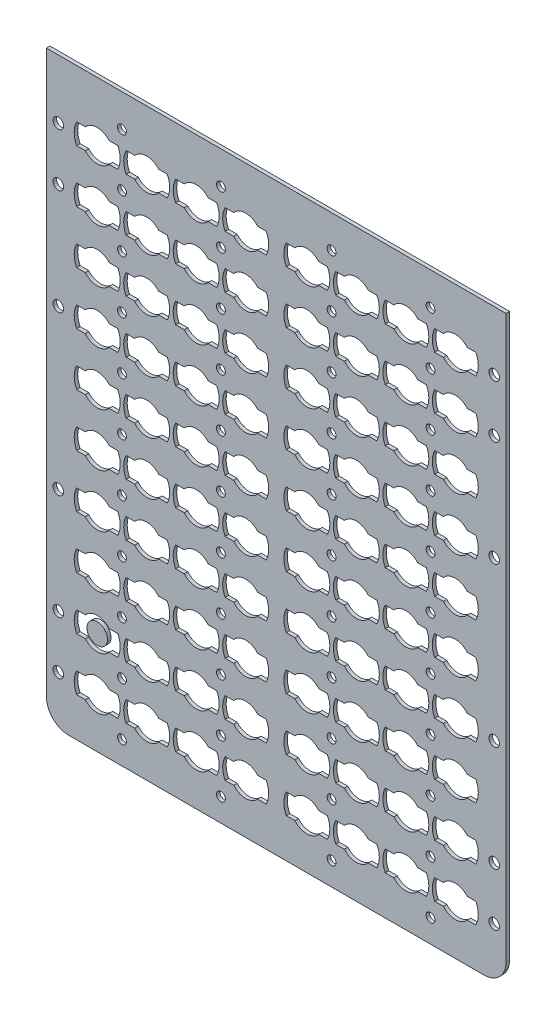
from build123d import *

# Parameters (mm, degrees)
SKETCH1_W            = 209.976
SKETCH1_H            = 266.785000002
SKETCH1_R            = 10.5
SKETCH1_R_2          = 1.527369009
SKETCH1_R_3          = 2.032
BOSS_EXTRUDE1_DEPTH  = 1.6
M4_CLEARANCE_HOLE1_D = 4.8
FILLET1_R            = 10.16
SKETCH5_R            = 4.699999998
SKETCH5_R_2          = 2.032
BOSS_EXTRUDE2_DEPTH  = 1.6


with BuildPart() as part:
    # Sketch1 → Boss-Extrude1 (new body)
    with BuildSketch(Plane.XY):
        with Locations((81.788, 110.787499999)):
            Rectangle(SKETCH1_W, SKETCH1_H)
        Circle(SKETCH1_R, mode=Mode.SUBTRACT)
        with Locations((22.606, 0)):
            Circle(SKETCH1_R, mode=Mode.SUBTRACT)
        with Locations((45.212, 0)):
            Circle(SKETCH1_R, mode=Mode.SUBTRACT)
        with Locations((67.818, 0)):
            Circle(SKETCH1_R, mode=Mode.SUBTRACT)
        with Locations((22.606, 24.13)):
            Circle(SKETCH1_R, mode=Mode.SUBTRACT)
        with Locations((45.212, 24.13)):
            Circle(SKETCH1_R, mode=Mode.SUBTRACT)
        with Locations((67.818, 24.13)):
            Circle(SKETCH1_R, mode=Mode.SUBTRACT)
        with Locations((22.606, 48.26)):
            Circle(SKETCH1_R, mode=Mode.SUBTRACT)
        with Locations((45.212, 48.26)):
            Circle(SKETCH1_R, mode=Mode.SUBTRACT)
        with Locations((67.818, 48.26)):
            Circle(SKETCH1_R, mode=Mode.SUBTRACT)
        with Locations((22.606, 72.39)):
            Circle(SKETCH1_R, mode=Mode.SUBTRACT)
        with Locations((45.212, 72.39)):
            Circle(SKETCH1_R, mode=Mode.SUBTRACT)
        with Locations((67.818, 72.39)):
            Circle(SKETCH1_R, mode=Mode.SUBTRACT)
        with Locations((22.606, 96.52)):
            Circle(SKETCH1_R, mode=Mode.SUBTRACT)
        with Locations((45.212, 96.52)):
            Circle(SKETCH1_R, mode=Mode.SUBTRACT)
        with Locations((67.818, 96.52)):
            Circle(SKETCH1_R, mode=Mode.SUBTRACT)
        with Locations((22.606, 120.65)):
            Circle(SKETCH1_R, mode=Mode.SUBTRACT)
        with Locations((45.212, 120.65)):
            Circle(SKETCH1_R, mode=Mode.SUBTRACT)
        with Locations((67.818, 120.65)):
            Circle(SKETCH1_R, mode=Mode.SUBTRACT)
        with Locations((22.606, 144.78)):
            Circle(SKETCH1_R, mode=Mode.SUBTRACT)
        with Locations((45.212, 144.78)):
            Circle(SKETCH1_R, mode=Mode.SUBTRACT)
        with Locations((67.818, 144.78)):
            Circle(SKETCH1_R, mode=Mode.SUBTRACT)
        with Locations((22.606, 168.91)):
            Circle(SKETCH1_R, mode=Mode.SUBTRACT)
        with Locations((45.212, 168.91)):
            Circle(SKETCH1_R, mode=Mode.SUBTRACT)
        with Locations((67.818, 168.91)):
            Circle(SKETCH1_R, mode=Mode.SUBTRACT)
        with Locations((22.606, 193.04)):
            Circle(SKETCH1_R, mode=Mode.SUBTRACT)
        with Locations((45.212, 193.04)):
            Circle(SKETCH1_R, mode=Mode.SUBTRACT)
        with Locations((67.818, 193.04)):
            Circle(SKETCH1_R, mode=Mode.SUBTRACT)
        with Locations((22.606, 217.17)):
            Circle(SKETCH1_R, mode=Mode.SUBTRACT)
        with Locations((45.212, 217.17)):
            Circle(SKETCH1_R, mode=Mode.SUBTRACT)
        with Locations((67.818, 217.17)):
            Circle(SKETCH1_R, mode=Mode.SUBTRACT)
        with Locations((0, 24.13)):
            Circle(SKETCH1_R, mode=Mode.SUBTRACT)
        with Locations((0, 48.26)):
            Circle(SKETCH1_R, mode=Mode.SUBTRACT)
        with Locations((0, 72.39)):
            Circle(SKETCH1_R, mode=Mode.SUBTRACT)
        with Locations((0, 96.52)):
            Circle(SKETCH1_R, mode=Mode.SUBTRACT)
        with Locations((0, 120.65)):
            Circle(SKETCH1_R, mode=Mode.SUBTRACT)
        with Locations((0, 144.78)):
            Circle(SKETCH1_R, mode=Mode.SUBTRACT)
        with Locations((0, 168.91)):
            Circle(SKETCH1_R, mode=Mode.SUBTRACT)
        with Locations((0, 193.04)):
            Circle(SKETCH1_R, mode=Mode.SUBTRACT)
        with Locations((0, 217.17)):
            Circle(SKETCH1_R, mode=Mode.SUBTRACT)
        with Locations((95.758, 0)):
            Circle(SKETCH1_R, mode=Mode.SUBTRACT)
        with Locations((118.364, 0)):
            Circle(SKETCH1_R, mode=Mode.SUBTRACT)
        with Locations((140.97, 0)):
            Circle(SKETCH1_R, mode=Mode.SUBTRACT)
        with Locations((163.576, 0)):
            Circle(SKETCH1_R, mode=Mode.SUBTRACT)
        with Locations((118.364, 24.13)):
            Circle(SKETCH1_R, mode=Mode.SUBTRACT)
        with Locations((140.97, 24.13)):
            Circle(SKETCH1_R, mode=Mode.SUBTRACT)
        with Locations((163.576, 24.13)):
            Circle(SKETCH1_R, mode=Mode.SUBTRACT)
        with Locations((118.364, 48.26)):
            Circle(SKETCH1_R, mode=Mode.SUBTRACT)
        with Locations((140.97, 48.26)):
            Circle(SKETCH1_R, mode=Mode.SUBTRACT)
        with Locations((163.576, 48.26)):
            Circle(SKETCH1_R, mode=Mode.SUBTRACT)
        with Locations((118.364, 72.39)):
            Circle(SKETCH1_R, mode=Mode.SUBTRACT)
        with Locations((140.97, 72.39)):
            Circle(SKETCH1_R, mode=Mode.SUBTRACT)
        with Locations((163.576, 72.39)):
            Circle(SKETCH1_R, mode=Mode.SUBTRACT)
        with Locations((118.364, 96.52)):
            Circle(SKETCH1_R, mode=Mode.SUBTRACT)
        with Locations((140.97, 96.52)):
            Circle(SKETCH1_R, mode=Mode.SUBTRACT)
        with Locations((163.576, 96.52)):
            Circle(SKETCH1_R, mode=Mode.SUBTRACT)
        with Locations((118.364, 120.65)):
            Circle(SKETCH1_R, mode=Mode.SUBTRACT)
        with Locations((140.97, 120.65)):
            Circle(SKETCH1_R, mode=Mode.SUBTRACT)
        with Locations((163.576, 120.65)):
            Circle(SKETCH1_R, mode=Mode.SUBTRACT)
        with Locations((118.364, 144.78)):
            Circle(SKETCH1_R, mode=Mode.SUBTRACT)
        with Locations((140.97, 144.78)):
            Circle(SKETCH1_R, mode=Mode.SUBTRACT)
        with Locations((163.576, 144.78)):
            Circle(SKETCH1_R, mode=Mode.SUBTRACT)
        with Locations((118.364, 168.91)):
            Circle(SKETCH1_R, mode=Mode.SUBTRACT)
        with Locations((140.97, 168.91)):
            Circle(SKETCH1_R, mode=Mode.SUBTRACT)
        with Locations((163.576, 168.91)):
            Circle(SKETCH1_R, mode=Mode.SUBTRACT)
        with Locations((118.364, 193.04)):
            Circle(SKETCH1_R, mode=Mode.SUBTRACT)
        with Locations((140.97, 193.04)):
            Circle(SKETCH1_R, mode=Mode.SUBTRACT)
        with Locations((163.576, 193.04)):
            Circle(SKETCH1_R, mode=Mode.SUBTRACT)
        with Locations((118.364, 217.17)):
            Circle(SKETCH1_R, mode=Mode.SUBTRACT)
        with Locations((140.97, 217.17)):
            Circle(SKETCH1_R, mode=Mode.SUBTRACT)
        with Locations((163.576, 217.17)):
            Circle(SKETCH1_R, mode=Mode.SUBTRACT)
        with Locations((95.758, 24.13)):
            Circle(SKETCH1_R, mode=Mode.SUBTRACT)
        with Locations((95.758, 48.26)):
            Circle(SKETCH1_R, mode=Mode.SUBTRACT)
        with Locations((95.758, 72.39)):
            Circle(SKETCH1_R, mode=Mode.SUBTRACT)
        with Locations((95.758, 96.52)):
            Circle(SKETCH1_R, mode=Mode.SUBTRACT)
        with Locations((95.758, 120.65)):
            Circle(SKETCH1_R, mode=Mode.SUBTRACT)
        with Locations((95.758, 144.78)):
            Circle(SKETCH1_R, mode=Mode.SUBTRACT)
        with Locations((95.758, 168.91)):
            Circle(SKETCH1_R, mode=Mode.SUBTRACT)
        with Locations((95.758, 193.04)):
            Circle(SKETCH1_R, mode=Mode.SUBTRACT)
        with Locations((95.758, 217.17)):
            Circle(SKETCH1_R, mode=Mode.SUBTRACT)
        with Locations((-17.769999938, 0)):
            Circle(SKETCH1_R_2, mode=Mode.SUBTRACT)
        with Locations((-17.769999938, 24.13)):
            Circle(SKETCH1_R_2, mode=Mode.SUBTRACT)
        with Locations((-17.769999938, 72.39)):
            Circle(SKETCH1_R_2, mode=Mode.SUBTRACT)
        with Locations((-17.769999938, 144.78)):
            Circle(SKETCH1_R_2, mode=Mode.SUBTRACT)
        with Locations((-17.769999938, 193.04)):
            Circle(SKETCH1_R_2, mode=Mode.SUBTRACT)
        with Locations((-17.769999938, 217.17)):
            Circle(SKETCH1_R_2, mode=Mode.SUBTRACT)
        with Locations(Location((181.345999938, 144.78, 0), (0, 0, 180))):
            Circle(SKETCH1_R_2, mode=Mode.SUBTRACT)
        with Locations(Location((181.345999938, 72.39, 0), (0, 0, 180))):
            Circle(SKETCH1_R_2, mode=Mode.SUBTRACT)
        with Locations(Location((181.345999938, 0, 0), (0, 0, 180))):
            Circle(SKETCH1_R_2, mode=Mode.SUBTRACT)
        with Locations(Location((181.345999938, 217.17, 0), (0, 0, 180))):
            Circle(SKETCH1_R_2, mode=Mode.SUBTRACT)
        with Locations((11.303, 12.065)):
            Circle(SKETCH1_R_3, mode=Mode.SUBTRACT)
        with Locations((56.515, 12.065)):
            Circle(SKETCH1_R_3, mode=Mode.SUBTRACT)
        with Locations((56.515, 36.195)):
            Circle(SKETCH1_R_3, mode=Mode.SUBTRACT)
        with Locations((56.515, 60.325)):
            Circle(SKETCH1_R_3, mode=Mode.SUBTRACT)
        with Locations((56.515, 84.455)):
            Circle(SKETCH1_R_3, mode=Mode.SUBTRACT)
        with Locations((56.515, 108.585)):
            Circle(SKETCH1_R_3, mode=Mode.SUBTRACT)
        with Locations((56.515, 132.715)):
            Circle(SKETCH1_R_3, mode=Mode.SUBTRACT)
        with Locations((56.515, 156.845)):
            Circle(SKETCH1_R_3, mode=Mode.SUBTRACT)
        with Locations((56.515, 180.975)):
            Circle(SKETCH1_R_3, mode=Mode.SUBTRACT)
        with Locations((56.515, 205.105)):
            Circle(SKETCH1_R_3, mode=Mode.SUBTRACT)
        with Locations((56.515, 229.235)):
            Circle(SKETCH1_R_3, mode=Mode.SUBTRACT)
        with Locations((11.303, 36.195)):
            Circle(SKETCH1_R_3, mode=Mode.SUBTRACT)
        with Locations((11.303, 60.325)):
            Circle(SKETCH1_R_3, mode=Mode.SUBTRACT)
        with Locations((11.303, 84.455)):
            Circle(SKETCH1_R_3, mode=Mode.SUBTRACT)
        with Locations((11.303, 108.585)):
            Circle(SKETCH1_R_3, mode=Mode.SUBTRACT)
        with Locations((11.303, 132.715)):
            Circle(SKETCH1_R_3, mode=Mode.SUBTRACT)
        with Locations((11.303, 156.845)):
            Circle(SKETCH1_R_3, mode=Mode.SUBTRACT)
        with Locations((11.303, 180.975)):
            Circle(SKETCH1_R_3, mode=Mode.SUBTRACT)
        with Locations((11.303, 205.105)):
            Circle(SKETCH1_R_3, mode=Mode.SUBTRACT)
        with Locations((11.303, 229.235)):
            Circle(SKETCH1_R_3, mode=Mode.SUBTRACT)
        with Locations((56.515, -12.065)):
            Circle(SKETCH1_R_3, mode=Mode.SUBTRACT)
        with Locations((11.303, -12.065)):
            Circle(SKETCH1_R_3, mode=Mode.SUBTRACT)
        with Locations(Location((107.061, 229.235, 0), (0, 0, 180))):
            Circle(SKETCH1_R_3, mode=Mode.SUBTRACT)
        with Locations(Location((152.273, 229.235, 0), (0, 0, 180))):
            Circle(SKETCH1_R_3, mode=Mode.SUBTRACT)
        with Locations(Location((152.273, 205.105, 0), (0, 0, 180))):
            Circle(SKETCH1_R_3, mode=Mode.SUBTRACT)
        with Locations(Location((107.061, 205.105, 0), (0, 0, 180))):
            Circle(SKETCH1_R_3, mode=Mode.SUBTRACT)
        with Locations(Location((107.061, 180.975, 0), (0, 0, 180))):
            Circle(SKETCH1_R_3, mode=Mode.SUBTRACT)
        with Locations(Location((152.273, 180.975, 0), (0, 0, 180))):
            Circle(SKETCH1_R_3, mode=Mode.SUBTRACT)
        with Locations(Location((152.273, 156.845, 0), (0, 0, 180))):
            Circle(SKETCH1_R_3, mode=Mode.SUBTRACT)
        with Locations(Location((107.061, 156.845, 0), (0, 0, 180))):
            Circle(SKETCH1_R_3, mode=Mode.SUBTRACT)
        with Locations(Location((107.061, 132.715, 0), (0, 0, 180))):
            Circle(SKETCH1_R_3, mode=Mode.SUBTRACT)
        with Locations(Location((152.273, 132.715, 0), (0, 0, 180))):
            Circle(SKETCH1_R_3, mode=Mode.SUBTRACT)
        with Locations(Location((152.273, 108.585, 0), (0, 0, 180))):
            Circle(SKETCH1_R_3, mode=Mode.SUBTRACT)
        with Locations(Location((107.061, 108.585, 0), (0, 0, 180))):
            Circle(SKETCH1_R_3, mode=Mode.SUBTRACT)
        with Locations(Location((107.061, 84.455, 0), (0, 0, 180))):
            Circle(SKETCH1_R_3, mode=Mode.SUBTRACT)
        with Locations(Location((152.273, 84.455, 0), (0, 0, 180))):
            Circle(SKETCH1_R_3, mode=Mode.SUBTRACT)
        with Locations(Location((152.273, 60.325, 0), (0, 0, 180))):
            Circle(SKETCH1_R_3, mode=Mode.SUBTRACT)
        with Locations(Location((107.061, 60.325, 0), (0, 0, 180))):
            Circle(SKETCH1_R_3, mode=Mode.SUBTRACT)
        with Locations(Location((107.061, 36.195, 0), (0, 0, 180))):
            Circle(SKETCH1_R_3, mode=Mode.SUBTRACT)
        with Locations(Location((152.273, 36.195, 0), (0, 0, 180))):
            Circle(SKETCH1_R_3, mode=Mode.SUBTRACT)
        with Locations(Location((152.273, 12.065, 0), (0, 0, 180))):
            Circle(SKETCH1_R_3, mode=Mode.SUBTRACT)
        with Locations(Location((107.061, 12.065, 0), (0, 0, 180))):
            Circle(SKETCH1_R_3, mode=Mode.SUBTRACT)
        with Locations(Location((107.061, -12.065, 0), (0, 0, 180))):
            Circle(SKETCH1_R_3, mode=Mode.SUBTRACT)
        with Locations(Location((152.273, -12.065, 0), (0, 0, 180))):
            Circle(SKETCH1_R_3, mode=Mode.SUBTRACT)
        with Locations(Location((181.345999938, 24.13, 0), (0, 0, 180))):
            Circle(SKETCH1_R_2, mode=Mode.SUBTRACT)
        with Locations(Location((181.345999938, 193.04, 0), (0, 0, 180))):
            Circle(SKETCH1_R_2, mode=Mode.SUBTRACT)
    extrude(amount=BOSS_EXTRUDE1_DEPTH)

    # M4 Clearance Hole1 (through all)
    with Locations(Plane.XY.offset(1.6)):
        with Locations((-17.769999938, 217.17), (-17.769999938, 144.78), (-17.769999938, 72.39), (-17.769999938, 0), (181.345999938, 0), (181.345999938, 72.39), (181.345999938, 144.78), (181.345999938, 217.17), (181.345999938, 24.13), (-17.769999938, 24.13), (-17.769999938, 193.04), (181.345999938, 193.04)):
            Hole(M4_CLEARANCE_HOLE1_D / 2)

    # Fillet1
    fillet1_edges = [part.edges().sort_by_distance(p)[0] for p in [
        (186.776, -22.605000002, 0.8),
        (-23.2, -22.605000002, 0.8),
    ]]
    fillet(fillet1_edges, radius=FILLET1_R)

    # Sketch5 → Boss-Extrude2 (add, through all)
    # profile 1 of 21: a face of its own
    with BuildSketch(Plane.XY.offset(1.6)):
        with Locations((0, 24.13)):
            Circle(SKETCH5_R)
    # profile 2 of 21: a face of its own
    with BuildSketch(Plane.XY.offset(1.6)):
        with BuildLine():
            Line((-10.5, 4.699999998), (-5.454356056, 4.699999998))
            ThreePointArc((-5.454356056, 4.699999998), (0, 7.199999998), (5.454356056, 4.699999998))
            Line((5.454356056, 4.699999998), (17.151643944, 4.699999998))
            ThreePointArc((17.151643944, 4.699999998), (22.606, 7.199999998), (28.060356056, 4.699999998))
            Line((28.060356056, 4.699999998), (39.757643944, 4.699999998))
            ThreePointArc((39.757643944, 4.699999998), (45.212, 7.199999998), (50.666356056, 4.699999998))
            Line((50.666356056, 4.699999998), (62.363643944, 4.699999998))
            ThreePointArc((62.363643944, 4.699999998), (67.818, 7.199999998), (73.272356056, 4.699999998))
            Line((73.272356056, 4.699999998), (78.318, 4.699999998))
            Line((78.318, 4.699999998), (78.318, 19.430000002))
            Line((78.318, 19.430000002), (73.272356056, 19.430000002))
            ThreePointArc((73.272356056, 19.430000002), (67.818, 16.930000002), (62.363643944, 19.430000002))
            Line((62.363643944, 19.430000002), (50.666356056, 19.430000002))
            ThreePointArc((50.666356056, 19.430000002), (45.212, 16.930000002), (39.757643944, 19.430000002))
            Line((39.757643944, 19.430000002), (28.060356056, 19.430000002))
            ThreePointArc((28.060356056, 19.430000002), (22.606, 16.930000002), (17.151643944, 19.430000002))
            Line((17.151643944, 19.430000002), (5.454356056, 19.430000002))
            ThreePointArc((5.454356056, 19.430000002), (0, 16.930000002), (-5.454356056, 19.430000002))
            Line((-5.454356056, 19.430000002), (-10.5, 19.430000002))
            Line((-10.5, 19.430000002), (-10.5, 4.699999998))
        make_face()
        with Locations((11.303, 12.065)):
            Circle(SKETCH5_R_2, mode=Mode.SUBTRACT)
        with Locations((56.515, 12.065)):
            Circle(SKETCH5_R_2, mode=Mode.SUBTRACT)
    # profile 3 of 21: a face of its own
    with BuildSketch(Plane.XY.offset(1.6)):
        with BuildLine():
            Line((-10.5, -4.699999998), (-5.454356056, -4.699999998))
            ThreePointArc((-5.454356056, -4.699999998), (0, -7.199999998), (5.454356056, -4.699999998))
            Line((5.454356056, -4.699999998), (17.151643944, -4.699999998))
            ThreePointArc((17.151643944, -4.699999998), (22.606, -7.199999998), (28.060356056, -4.699999998))
            Line((28.060356056, -4.699999998), (39.757643944, -4.699999998))
            ThreePointArc((39.757643944, -4.699999998), (45.212, -7.199999998), (50.666356056, -4.699999998))
            Line((50.666356056, -4.699999998), (62.363643944, -4.699999998))
            ThreePointArc((62.363643944, -4.699999998), (67.818, -7.199999998), (73.272356056, -4.699999998))
            Line((73.272356056, -4.699999998), (90.303643944, -4.699999998))
            ThreePointArc((90.303643944, -4.699999998), (95.758, -7.199999998), (101.212356056, -4.699999998))
            Line((101.212356056, -4.699999998), (112.909643944, -4.699999998))
            ThreePointArc((112.909643944, -4.699999998), (118.364, -7.199999998), (123.818356056, -4.699999998))
            Line((123.818356056, -4.699999998), (135.515643944, -4.699999998))
            ThreePointArc((135.515643944, -4.699999998), (140.97, -7.199999998), (146.424356056, -4.699999998))
            Line((146.424356056, -4.699999998), (158.121643944, -4.699999998))
            ThreePointArc((158.121643944, -4.699999998), (163.576, -7.199999998), (169.030356056, -4.699999998))
            Line((169.030356056, -4.699999998), (174.076, -4.699999998))
            Line((174.076, -4.699999998), (174.076, -19.430000002))
            Line((174.076, -19.430000002), (-10.5, -19.430000002))
            Line((-10.5, -19.430000002), (-10.5, -4.699999998))
        make_face()
        with Locations((11.303, -12.065)):
            Circle(SKETCH5_R_2, mode=Mode.SUBTRACT)
        with Locations((56.515, -12.065)):
            Circle(SKETCH5_R_2, mode=Mode.SUBTRACT)
        with Locations(Location((107.061, -12.065, 0), (0, 0, 180))):
            Circle(SKETCH5_R_2, mode=Mode.SUBTRACT)
        with Locations(Location((152.273, -12.065, 0), (0, 0, 180))):
            Circle(SKETCH5_R_2, mode=Mode.SUBTRACT)
    # profile 4 of 21: a face of its own
    with BuildSketch(Plane.XY.offset(1.6)):
        with BuildLine():
            Line((158.121643944, 19.430000002), (146.424356056, 19.430000002))
            ThreePointArc((146.424356056, 19.430000002), (140.97, 16.930000002), (135.515643944, 19.430000002))
            Line((135.515643944, 19.430000002), (123.818356056, 19.430000002))
            ThreePointArc((123.818356056, 19.430000002), (118.364, 16.930000002), (112.909643944, 19.430000002))
            Line((112.909643944, 19.430000002), (101.212356056, 19.430000002))
            ThreePointArc((101.212356056, 19.430000002), (95.758, 16.930000002), (90.303643944, 19.430000002))
            Line((90.303643944, 19.430000002), (85.258, 19.430000002))
            Line((85.258, 19.430000002), (85.258, 4.699999998))
            Line((85.258, 4.699999998), (90.303643944, 4.699999998))
            ThreePointArc((90.303643944, 4.699999998), (95.758, 7.199999998), (101.212356056, 4.699999998))
            Line((101.212356056, 4.699999998), (112.909643944, 4.699999998))
            ThreePointArc((112.909643944, 4.699999998), (118.364, 7.199999998), (123.818356056, 4.699999998))
            Line((123.818356056, 4.699999998), (135.515643944, 4.699999998))
            ThreePointArc((135.515643944, 4.699999998), (140.97, 7.199999998), (146.424356056, 4.699999998))
            Line((146.424356056, 4.699999998), (158.121643944, 4.699999998))
            ThreePointArc((158.121643944, 4.699999998), (163.576, 7.199999998), (169.030356056, 4.699999998))
            Line((169.030356056, 4.699999998), (174.076, 4.699999998))
            Line((174.076, 4.699999998), (174.076, 19.430000002))
            Line((174.076, 19.430000002), (169.030356056, 19.430000002))
            ThreePointArc((169.030356056, 19.430000002), (163.576, 16.930000002), (158.121643944, 19.430000002))
        make_face()
        with Locations(Location((107.061, 12.065, 0), (0, 0, 180))):
            Circle(SKETCH5_R_2, mode=Mode.SUBTRACT)
        with Locations(Location((152.273, 12.065, 0), (0, 0, 180))):
            Circle(SKETCH5_R_2, mode=Mode.SUBTRACT)
    # profile 5 of 21: a face of its own
    with BuildSketch(Plane.XY.offset(1.6)):
        with BuildLine():
            Line((5.454356056, 28.829999998), (17.151643944, 28.829999998))
            ThreePointArc((17.151643944, 28.829999998), (22.606, 31.329999998), (28.060356056, 28.829999998))
            Line((28.060356056, 28.829999998), (39.757643944, 28.829999998))
            ThreePointArc((39.757643944, 28.829999998), (45.212, 31.329999998), (50.666356056, 28.829999998))
            Line((50.666356056, 28.829999998), (62.363643944, 28.829999998))
            ThreePointArc((62.363643944, 28.829999998), (67.818, 31.329999998), (73.272356056, 28.829999998))
            Line((73.272356056, 28.829999998), (78.318, 28.829999998))
            Line((78.318, 28.829999998), (78.318, 43.560000002))
            Line((78.318, 43.560000002), (73.272356056, 43.560000002))
            ThreePointArc((73.272356056, 43.560000002), (67.818, 41.060000002), (62.363643944, 43.560000002))
            Line((62.363643944, 43.560000002), (50.666356056, 43.560000002))
            ThreePointArc((50.666356056, 43.560000002), (45.212, 41.060000002), (39.757643944, 43.560000002))
            Line((39.757643944, 43.560000002), (28.060356056, 43.560000002))
            ThreePointArc((28.060356056, 43.560000002), (22.606, 41.060000002), (17.151643944, 43.560000002))
            Line((17.151643944, 43.560000002), (5.454356056, 43.560000002))
            ThreePointArc((5.454356056, 43.560000002), (0, 41.060000002), (-5.454356056, 43.560000002))
            Line((-5.454356056, 43.560000002), (-10.5, 43.560000002))
            Line((-10.5, 43.560000002), (-10.5, 28.829999998))
            Line((-10.5, 28.829999998), (-5.454356056, 28.829999998))
            ThreePointArc((-5.454356056, 28.829999998), (0, 31.329999998), (5.454356056, 28.829999998))
        make_face()
        with Locations((11.303, 36.195)):
            Circle(SKETCH5_R_2, mode=Mode.SUBTRACT)
        with Locations((56.515, 36.195)):
            Circle(SKETCH5_R_2, mode=Mode.SUBTRACT)
    # profile 6 of 21: a face of its own
    with BuildSketch(Plane.XY.offset(1.6)):
        with BuildLine():
            Line((158.121643944, 43.560000002), (146.424356056, 43.560000002))
            ThreePointArc((146.424356056, 43.560000002), (140.97, 41.060000002), (135.515643944, 43.560000002))
            Line((135.515643944, 43.560000002), (123.818356056, 43.560000002))
            ThreePointArc((123.818356056, 43.560000002), (118.364, 41.060000002), (112.909643944, 43.560000002))
            Line((112.909643944, 43.560000002), (101.212356056, 43.560000002))
            ThreePointArc((101.212356056, 43.560000002), (95.758, 41.060000002), (90.303643944, 43.560000002))
            Line((90.303643944, 43.560000002), (85.258, 43.560000002))
            Line((85.258, 43.560000002), (85.258, 28.829999998))
            Line((85.258, 28.829999998), (90.303643944, 28.829999998))
            ThreePointArc((90.303643944, 28.829999998), (95.758, 31.329999998), (101.212356056, 28.829999998))
            Line((101.212356056, 28.829999998), (112.909643944, 28.829999998))
            ThreePointArc((112.909643944, 28.829999998), (118.364, 31.329999998), (123.818356056, 28.829999998))
            Line((123.818356056, 28.829999998), (135.515643944, 28.829999998))
            ThreePointArc((135.515643944, 28.829999998), (140.97, 31.329999998), (146.424356056, 28.829999998))
            Line((146.424356056, 28.829999998), (158.121643944, 28.829999998))
            ThreePointArc((158.121643944, 28.829999998), (163.576, 31.329999998), (169.030356056, 28.829999998))
            Line((169.030356056, 28.829999998), (174.076, 28.829999998))
            Line((174.076, 28.829999998), (174.076, 43.560000002))
            Line((174.076, 43.560000002), (169.030356056, 43.560000002))
            ThreePointArc((169.030356056, 43.560000002), (163.576, 41.060000002), (158.121643944, 43.560000002))
        make_face()
        with Locations(Location((107.061, 36.195, 0), (0, 0, 180))):
            Circle(SKETCH5_R_2, mode=Mode.SUBTRACT)
        with Locations(Location((152.273, 36.195, 0), (0, 0, 180))):
            Circle(SKETCH5_R_2, mode=Mode.SUBTRACT)
    # profile 7 of 21: a face of its own
    with BuildSketch(Plane.XY.offset(1.6)):
        with BuildLine():
            Line((5.454356056, 52.959999998), (17.151643944, 52.959999998))
            ThreePointArc((17.151643944, 52.959999998), (22.606, 55.459999998), (28.060356056, 52.959999998))
            Line((28.060356056, 52.959999998), (39.757643944, 52.959999998))
            ThreePointArc((39.757643944, 52.959999998), (45.212, 55.459999998), (50.666356056, 52.959999998))
            Line((50.666356056, 52.959999998), (62.363643944, 52.959999998))
            ThreePointArc((62.363643944, 52.959999998), (67.818, 55.459999998), (73.272356056, 52.959999998))
            Line((73.272356056, 52.959999998), (78.318, 52.959999998))
            Line((78.318, 52.959999998), (78.318, 67.690000002))
            Line((78.318, 67.690000002), (73.272356056, 67.690000002))
            ThreePointArc((73.272356056, 67.690000002), (67.818, 65.190000002), (62.363643944, 67.690000002))
            Line((62.363643944, 67.690000002), (50.666356056, 67.690000002))
            ThreePointArc((50.666356056, 67.690000002), (45.212, 65.190000002), (39.757643944, 67.690000002))
            Line((39.757643944, 67.690000002), (28.060356056, 67.690000002))
            ThreePointArc((28.060356056, 67.690000002), (22.606, 65.190000002), (17.151643944, 67.690000002))
            Line((17.151643944, 67.690000002), (5.454356056, 67.690000002))
            ThreePointArc((5.454356056, 67.690000002), (0, 65.190000002), (-5.454356056, 67.690000002))
            Line((-5.454356056, 67.690000002), (-10.5, 67.690000002))
            Line((-10.5, 67.690000002), (-10.5, 52.959999998))
            Line((-10.5, 52.959999998), (-5.454356056, 52.959999998))
            ThreePointArc((-5.454356056, 52.959999998), (0, 55.459999998), (5.454356056, 52.959999998))
        make_face()
        with Locations((11.303, 60.325)):
            Circle(SKETCH5_R_2, mode=Mode.SUBTRACT)
        with Locations((56.515, 60.325)):
            Circle(SKETCH5_R_2, mode=Mode.SUBTRACT)
    # profile 8 of 21: a face of its own
    with BuildSketch(Plane.XY.offset(1.6)):
        with BuildLine():
            Line((158.121643944, 67.690000002), (146.424356056, 67.690000002))
            ThreePointArc((146.424356056, 67.690000002), (140.97, 65.190000002), (135.515643944, 67.690000002))
            Line((135.515643944, 67.690000002), (123.818356056, 67.690000002))
            ThreePointArc((123.818356056, 67.690000002), (118.364, 65.190000002), (112.909643944, 67.690000002))
            Line((112.909643944, 67.690000002), (101.212356056, 67.690000002))
            ThreePointArc((101.212356056, 67.690000002), (95.758, 65.190000002), (90.303643944, 67.690000002))
            Line((90.303643944, 67.690000002), (85.258, 67.690000002))
            Line((85.258, 67.690000002), (85.258, 52.959999998))
            Line((85.258, 52.959999998), (90.303643944, 52.959999998))
            ThreePointArc((90.303643944, 52.959999998), (95.758, 55.459999998), (101.212356056, 52.959999998))
            Line((101.212356056, 52.959999998), (112.909643944, 52.959999998))
            ThreePointArc((112.909643944, 52.959999998), (118.364, 55.459999998), (123.818356056, 52.959999998))
            Line((123.818356056, 52.959999998), (135.515643944, 52.959999998))
            ThreePointArc((135.515643944, 52.959999998), (140.97, 55.459999998), (146.424356056, 52.959999998))
            Line((146.424356056, 52.959999998), (158.121643944, 52.959999998))
            ThreePointArc((158.121643944, 52.959999998), (163.576, 55.459999998), (169.030356056, 52.959999998))
            Line((169.030356056, 52.959999998), (174.076, 52.959999998))
            Line((174.076, 52.959999998), (174.076, 67.690000002))
            Line((174.076, 67.690000002), (169.030356056, 67.690000002))
            ThreePointArc((169.030356056, 67.690000002), (163.576, 65.190000002), (158.121643944, 67.690000002))
        make_face()
        with Locations(Location((107.061, 60.325, 0), (0, 0, 180))):
            Circle(SKETCH5_R_2, mode=Mode.SUBTRACT)
        with Locations(Location((152.273, 60.325, 0), (0, 0, 180))):
            Circle(SKETCH5_R_2, mode=Mode.SUBTRACT)
    # profile 9 of 21: a face of its own
    with BuildSketch(Plane.XY.offset(1.6)):
        with BuildLine():
            Line((5.454356056, 77.089999998), (17.151643944, 77.089999998))
            ThreePointArc((17.151643944, 77.089999998), (22.606, 79.589999998), (28.060356056, 77.089999998))
            Line((28.060356056, 77.089999998), (39.757643944, 77.089999998))
            ThreePointArc((39.757643944, 77.089999998), (45.212, 79.589999998), (50.666356056, 77.089999998))
            Line((50.666356056, 77.089999998), (62.363643944, 77.089999998))
            ThreePointArc((62.363643944, 77.089999998), (67.818, 79.589999998), (73.272356056, 77.089999998))
            Line((73.272356056, 77.089999998), (78.318, 77.089999998))
            Line((78.318, 77.089999998), (78.318, 91.820000002))
            Line((78.318, 91.820000002), (73.272356056, 91.820000002))
            ThreePointArc((73.272356056, 91.820000002), (67.818, 89.320000002), (62.363643944, 91.820000002))
            Line((62.363643944, 91.820000002), (50.666356056, 91.820000002))
            ThreePointArc((50.666356056, 91.820000002), (45.212, 89.320000002), (39.757643944, 91.820000002))
            Line((39.757643944, 91.820000002), (28.060356056, 91.820000002))
            ThreePointArc((28.060356056, 91.820000002), (22.606, 89.320000002), (17.151643944, 91.820000002))
            Line((17.151643944, 91.820000002), (5.454356056, 91.820000002))
            ThreePointArc((5.454356056, 91.820000002), (0, 89.320000002), (-5.454356056, 91.820000002))
            Line((-5.454356056, 91.820000002), (-10.5, 91.820000002))
            Line((-10.5, 91.820000002), (-10.5, 77.089999998))
            Line((-10.5, 77.089999998), (-5.454356056, 77.089999998))
            ThreePointArc((-5.454356056, 77.089999998), (0, 79.589999998), (5.454356056, 77.089999998))
        make_face()
        with Locations((11.303, 84.455)):
            Circle(SKETCH5_R_2, mode=Mode.SUBTRACT)
        with Locations((56.515, 84.455)):
            Circle(SKETCH5_R_2, mode=Mode.SUBTRACT)
    # profile 10 of 21: a face of its own
    with BuildSketch(Plane.XY.offset(1.6)):
        with BuildLine():
            Line((158.121643944, 91.820000002), (146.424356056, 91.820000002))
            ThreePointArc((146.424356056, 91.820000002), (140.97, 89.320000002), (135.515643944, 91.820000002))
            Line((135.515643944, 91.820000002), (123.818356056, 91.820000002))
            ThreePointArc((123.818356056, 91.820000002), (118.364, 89.320000002), (112.909643944, 91.820000002))
            Line((112.909643944, 91.820000002), (101.212356056, 91.820000002))
            ThreePointArc((101.212356056, 91.820000002), (95.758, 89.320000002), (90.303643944, 91.820000002))
            Line((90.303643944, 91.820000002), (85.258, 91.820000002))
            Line((85.258, 91.820000002), (85.258, 77.089999998))
            Line((85.258, 77.089999998), (90.303643944, 77.089999998))
            ThreePointArc((90.303643944, 77.089999998), (95.758, 79.589999998), (101.212356056, 77.089999998))
            Line((101.212356056, 77.089999998), (112.909643944, 77.089999998))
            ThreePointArc((112.909643944, 77.089999998), (118.364, 79.589999998), (123.818356056, 77.089999998))
            Line((123.818356056, 77.089999998), (135.515643944, 77.089999998))
            ThreePointArc((135.515643944, 77.089999998), (140.97, 79.589999998), (146.424356056, 77.089999998))
            Line((146.424356056, 77.089999998), (158.121643944, 77.089999998))
            ThreePointArc((158.121643944, 77.089999998), (163.576, 79.589999998), (169.030356056, 77.089999998))
            Line((169.030356056, 77.089999998), (174.076, 77.089999998))
            Line((174.076, 77.089999998), (174.076, 91.820000002))
            Line((174.076, 91.820000002), (169.030356056, 91.820000002))
            ThreePointArc((169.030356056, 91.820000002), (163.576, 89.320000002), (158.121643944, 91.820000002))
        make_face()
        with Locations(Location((107.061, 84.455, 0), (0, 0, 180))):
            Circle(SKETCH5_R_2, mode=Mode.SUBTRACT)
        with Locations(Location((152.273, 84.455, 0), (0, 0, 180))):
            Circle(SKETCH5_R_2, mode=Mode.SUBTRACT)
    # profile 11 of 21: a face of its own
    with BuildSketch(Plane.XY.offset(1.6)):
        with BuildLine():
            Line((5.454356056, 101.219999998), (17.151643944, 101.219999998))
            ThreePointArc((17.151643944, 101.219999998), (22.606, 103.719999998), (28.060356056, 101.219999998))
            Line((28.060356056, 101.219999998), (39.757643944, 101.219999998))
            ThreePointArc((39.757643944, 101.219999998), (45.212, 103.719999998), (50.666356056, 101.219999998))
            Line((50.666356056, 101.219999998), (62.363643944, 101.219999998))
            ThreePointArc((62.363643944, 101.219999998), (67.818, 103.719999998), (73.272356056, 101.219999998))
            Line((73.272356056, 101.219999998), (78.318, 101.219999998))
            Line((78.318, 101.219999998), (78.318, 115.950000002))
            Line((78.318, 115.950000002), (73.272356056, 115.950000002))
            ThreePointArc((73.272356056, 115.950000002), (67.818, 113.450000002), (62.363643944, 115.950000002))
            Line((62.363643944, 115.950000002), (50.666356056, 115.950000002))
            ThreePointArc((50.666356056, 115.950000002), (45.212, 113.450000002), (39.757643944, 115.950000002))
            Line((39.757643944, 115.950000002), (28.060356056, 115.950000002))
            ThreePointArc((28.060356056, 115.950000002), (22.606, 113.450000002), (17.151643944, 115.950000002))
            Line((17.151643944, 115.950000002), (5.454356056, 115.950000002))
            ThreePointArc((5.454356056, 115.950000002), (0, 113.450000002), (-5.454356056, 115.950000002))
            Line((-5.454356056, 115.950000002), (-10.5, 115.950000002))
            Line((-10.5, 115.950000002), (-10.5, 101.219999998))
            Line((-10.5, 101.219999998), (-5.454356056, 101.219999998))
            ThreePointArc((-5.454356056, 101.219999998), (0, 103.719999998), (5.454356056, 101.219999998))
        make_face()
        with Locations((11.303, 108.585)):
            Circle(SKETCH5_R_2, mode=Mode.SUBTRACT)
        with Locations((56.515, 108.585)):
            Circle(SKETCH5_R_2, mode=Mode.SUBTRACT)
    # profile 12 of 21: a face of its own
    with BuildSketch(Plane.XY.offset(1.6)):
        with BuildLine():
            Line((158.121643944, 115.950000002), (146.424356056, 115.950000002))
            ThreePointArc((146.424356056, 115.950000002), (140.97, 113.450000002), (135.515643944, 115.950000002))
            Line((135.515643944, 115.950000002), (123.818356056, 115.950000002))
            ThreePointArc((123.818356056, 115.950000002), (118.364, 113.450000002), (112.909643944, 115.950000002))
            Line((112.909643944, 115.950000002), (101.212356056, 115.950000002))
            ThreePointArc((101.212356056, 115.950000002), (95.758, 113.450000002), (90.303643944, 115.950000002))
            Line((90.303643944, 115.950000002), (85.258, 115.950000002))
            Line((85.258, 115.950000002), (85.258, 101.219999998))
            Line((85.258, 101.219999998), (90.303643944, 101.219999998))
            ThreePointArc((90.303643944, 101.219999998), (95.758, 103.719999998), (101.212356056, 101.219999998))
            Line((101.212356056, 101.219999998), (112.909643944, 101.219999998))
            ThreePointArc((112.909643944, 101.219999998), (118.364, 103.719999998), (123.818356056, 101.219999998))
            Line((123.818356056, 101.219999998), (135.515643944, 101.219999998))
            ThreePointArc((135.515643944, 101.219999998), (140.97, 103.719999998), (146.424356056, 101.219999998))
            Line((146.424356056, 101.219999998), (158.121643944, 101.219999998))
            ThreePointArc((158.121643944, 101.219999998), (163.576, 103.719999998), (169.030356056, 101.219999998))
            Line((169.030356056, 101.219999998), (174.076, 101.219999998))
            Line((174.076, 101.219999998), (174.076, 115.950000002))
            Line((174.076, 115.950000002), (169.030356056, 115.950000002))
            ThreePointArc((169.030356056, 115.950000002), (163.576, 113.450000002), (158.121643944, 115.950000002))
        make_face()
        with Locations(Location((107.061, 108.585, 0), (0, 0, 180))):
            Circle(SKETCH5_R_2, mode=Mode.SUBTRACT)
        with Locations(Location((152.273, 108.585, 0), (0, 0, 180))):
            Circle(SKETCH5_R_2, mode=Mode.SUBTRACT)
    # profile 13 of 21: a face of its own
    with BuildSketch(Plane.XY.offset(1.6)):
        with BuildLine():
            Line((5.454356056, 125.349999998), (17.151643944, 125.349999998))
            ThreePointArc((17.151643944, 125.349999998), (22.606, 127.849999998), (28.060356056, 125.349999998))
            Line((28.060356056, 125.349999998), (39.757643944, 125.349999998))
            ThreePointArc((39.757643944, 125.349999998), (45.212, 127.849999998), (50.666356056, 125.349999998))
            Line((50.666356056, 125.349999998), (62.363643944, 125.349999998))
            ThreePointArc((62.363643944, 125.349999998), (67.818, 127.849999998), (73.272356056, 125.349999998))
            Line((73.272356056, 125.349999998), (78.318, 125.349999998))
            Line((78.318, 125.349999998), (78.318, 140.080000002))
            Line((78.318, 140.080000002), (73.272356056, 140.080000002))
            ThreePointArc((73.272356056, 140.080000002), (67.818, 137.580000002), (62.363643944, 140.080000002))
            Line((62.363643944, 140.080000002), (50.666356056, 140.080000002))
            ThreePointArc((50.666356056, 140.080000002), (45.212, 137.580000002), (39.757643944, 140.080000002))
            Line((39.757643944, 140.080000002), (28.060356056, 140.080000002))
            ThreePointArc((28.060356056, 140.080000002), (22.606, 137.580000002), (17.151643944, 140.080000002))
            Line((17.151643944, 140.080000002), (5.454356056, 140.080000002))
            ThreePointArc((5.454356056, 140.080000002), (0, 137.580000002), (-5.454356056, 140.080000002))
            Line((-5.454356056, 140.080000002), (-10.5, 140.080000002))
            Line((-10.5, 140.080000002), (-10.5, 125.349999998))
            Line((-10.5, 125.349999998), (-5.454356056, 125.349999998))
            ThreePointArc((-5.454356056, 125.349999998), (0, 127.849999998), (5.454356056, 125.349999998))
        make_face()
        with Locations((11.303, 132.715)):
            Circle(SKETCH5_R_2, mode=Mode.SUBTRACT)
        with Locations((56.515, 132.715)):
            Circle(SKETCH5_R_2, mode=Mode.SUBTRACT)
    # profile 14 of 21: a face of its own
    with BuildSketch(Plane.XY.offset(1.6)):
        with BuildLine():
            Line((158.121643944, 140.080000002), (146.424356056, 140.080000002))
            ThreePointArc((146.424356056, 140.080000002), (140.97, 137.580000002), (135.515643944, 140.080000002))
            Line((135.515643944, 140.080000002), (123.818356056, 140.080000002))
            ThreePointArc((123.818356056, 140.080000002), (118.364, 137.580000002), (112.909643944, 140.080000002))
            Line((112.909643944, 140.080000002), (101.212356056, 140.080000002))
            ThreePointArc((101.212356056, 140.080000002), (95.758, 137.580000002), (90.303643944, 140.080000002))
            Line((90.303643944, 140.080000002), (85.258, 140.080000002))
            Line((85.258, 140.080000002), (85.258, 125.349999998))
            Line((85.258, 125.349999998), (90.303643944, 125.349999998))
            ThreePointArc((90.303643944, 125.349999998), (95.758, 127.849999998), (101.212356056, 125.349999998))
            Line((101.212356056, 125.349999998), (112.909643944, 125.349999998))
            ThreePointArc((112.909643944, 125.349999998), (118.364, 127.849999998), (123.818356056, 125.349999998))
            Line((123.818356056, 125.349999998), (135.515643944, 125.349999998))
            ThreePointArc((135.515643944, 125.349999998), (140.97, 127.849999998), (146.424356056, 125.349999998))
            Line((146.424356056, 125.349999998), (158.121643944, 125.349999998))
            ThreePointArc((158.121643944, 125.349999998), (163.576, 127.849999998), (169.030356056, 125.349999998))
            Line((169.030356056, 125.349999998), (174.076, 125.349999998))
            Line((174.076, 125.349999998), (174.076, 140.080000002))
            Line((174.076, 140.080000002), (169.030356056, 140.080000002))
            ThreePointArc((169.030356056, 140.080000002), (163.576, 137.580000002), (158.121643944, 140.080000002))
        make_face()
        with Locations(Location((107.061, 132.715, 0), (0, 0, 180))):
            Circle(SKETCH5_R_2, mode=Mode.SUBTRACT)
        with Locations(Location((152.273, 132.715, 0), (0, 0, 180))):
            Circle(SKETCH5_R_2, mode=Mode.SUBTRACT)
    # profile 15 of 21: a face of its own
    with BuildSketch(Plane.XY.offset(1.6)):
        with BuildLine():
            Line((5.454356056, 149.479999998), (17.151643944, 149.479999998))
            ThreePointArc((17.151643944, 149.479999998), (22.606, 151.979999998), (28.060356056, 149.479999998))
            Line((28.060356056, 149.479999998), (39.757643944, 149.479999998))
            ThreePointArc((39.757643944, 149.479999998), (45.212, 151.979999998), (50.666356056, 149.479999998))
            Line((50.666356056, 149.479999998), (62.363643944, 149.479999998))
            ThreePointArc((62.363643944, 149.479999998), (67.818, 151.979999998), (73.272356056, 149.479999998))
            Line((73.272356056, 149.479999998), (78.318, 149.479999998))
            Line((78.318, 149.479999998), (78.318, 164.210000002))
            Line((78.318, 164.210000002), (73.272356056, 164.210000002))
            ThreePointArc((73.272356056, 164.210000002), (67.818, 161.710000002), (62.363643944, 164.210000002))
            Line((62.363643944, 164.210000002), (50.666356056, 164.210000002))
            ThreePointArc((50.666356056, 164.210000002), (45.212, 161.710000002), (39.757643944, 164.210000002))
            Line((39.757643944, 164.210000002), (28.060356056, 164.210000002))
            ThreePointArc((28.060356056, 164.210000002), (22.606, 161.710000002), (17.151643944, 164.210000002))
            Line((17.151643944, 164.210000002), (5.454356056, 164.210000002))
            ThreePointArc((5.454356056, 164.210000002), (0, 161.710000002), (-5.454356056, 164.210000002))
            Line((-5.454356056, 164.210000002), (-10.5, 164.210000002))
            Line((-10.5, 164.210000002), (-10.5, 149.479999998))
            Line((-10.5, 149.479999998), (-5.454356056, 149.479999998))
            ThreePointArc((-5.454356056, 149.479999998), (0, 151.979999998), (5.454356056, 149.479999998))
        make_face()
        with Locations((11.303, 156.845)):
            Circle(SKETCH5_R_2, mode=Mode.SUBTRACT)
        with Locations((56.515, 156.845)):
            Circle(SKETCH5_R_2, mode=Mode.SUBTRACT)
    # profile 16 of 21: a face of its own
    with BuildSketch(Plane.XY.offset(1.6)):
        with BuildLine():
            Line((158.121643944, 164.210000002), (146.424356056, 164.210000002))
            ThreePointArc((146.424356056, 164.210000002), (140.97, 161.710000002), (135.515643944, 164.210000002))
            Line((135.515643944, 164.210000002), (123.818356056, 164.210000002))
            ThreePointArc((123.818356056, 164.210000002), (118.364, 161.710000002), (112.909643944, 164.210000002))
            Line((112.909643944, 164.210000002), (101.212356056, 164.210000002))
            ThreePointArc((101.212356056, 164.210000002), (95.758, 161.710000002), (90.303643944, 164.210000002))
            Line((90.303643944, 164.210000002), (85.258, 164.210000002))
            Line((85.258, 164.210000002), (85.258, 149.479999998))
            Line((85.258, 149.479999998), (90.303643944, 149.479999998))
            ThreePointArc((90.303643944, 149.479999998), (95.758, 151.979999998), (101.212356056, 149.479999998))
            Line((101.212356056, 149.479999998), (112.909643944, 149.479999998))
            ThreePointArc((112.909643944, 149.479999998), (118.364, 151.979999998), (123.818356056, 149.479999998))
            Line((123.818356056, 149.479999998), (135.515643944, 149.479999998))
            ThreePointArc((135.515643944, 149.479999998), (140.97, 151.979999998), (146.424356056, 149.479999998))
            Line((146.424356056, 149.479999998), (158.121643944, 149.479999998))
            ThreePointArc((158.121643944, 149.479999998), (163.576, 151.979999998), (169.030356056, 149.479999998))
            Line((169.030356056, 149.479999998), (174.076, 149.479999998))
            Line((174.076, 149.479999998), (174.076, 164.210000002))
            Line((174.076, 164.210000002), (169.030356056, 164.210000002))
            ThreePointArc((169.030356056, 164.210000002), (163.576, 161.710000002), (158.121643944, 164.210000002))
        make_face()
        with Locations(Location((107.061, 156.845, 0), (0, 0, 180))):
            Circle(SKETCH5_R_2, mode=Mode.SUBTRACT)
        with Locations(Location((152.273, 156.845, 0), (0, 0, 180))):
            Circle(SKETCH5_R_2, mode=Mode.SUBTRACT)
    # profile 17 of 21: a face of its own
    with BuildSketch(Plane.XY.offset(1.6)):
        with BuildLine():
            Line((5.454356056, 173.609999998), (17.151643944, 173.609999998))
            ThreePointArc((17.151643944, 173.609999998), (22.606, 176.109999998), (28.060356056, 173.609999998))
            Line((28.060356056, 173.609999998), (39.757643944, 173.609999998))
            ThreePointArc((39.757643944, 173.609999998), (45.212, 176.109999998), (50.666356056, 173.609999998))
            Line((50.666356056, 173.609999998), (62.363643944, 173.609999998))
            ThreePointArc((62.363643944, 173.609999998), (67.818, 176.109999998), (73.272356056, 173.609999998))
            Line((73.272356056, 173.609999998), (78.318, 173.609999998))
            Line((78.318, 173.609999998), (78.318, 188.340000002))
            Line((78.318, 188.340000002), (73.272356056, 188.340000002))
            ThreePointArc((73.272356056, 188.340000002), (67.818, 185.840000002), (62.363643944, 188.340000002))
            Line((62.363643944, 188.340000002), (50.666356056, 188.340000002))
            ThreePointArc((50.666356056, 188.340000002), (45.212, 185.840000002), (39.757643944, 188.340000002))
            Line((39.757643944, 188.340000002), (28.060356056, 188.340000002))
            ThreePointArc((28.060356056, 188.340000002), (22.606, 185.840000002), (17.151643944, 188.340000002))
            Line((17.151643944, 188.340000002), (5.454356056, 188.340000002))
            ThreePointArc((5.454356056, 188.340000002), (0, 185.840000002), (-5.454356056, 188.340000002))
            Line((-5.454356056, 188.340000002), (-10.5, 188.340000002))
            Line((-10.5, 188.340000002), (-10.5, 173.609999998))
            Line((-10.5, 173.609999998), (-5.454356056, 173.609999998))
            ThreePointArc((-5.454356056, 173.609999998), (0, 176.109999998), (5.454356056, 173.609999998))
        make_face()
        with Locations((11.303, 180.975)):
            Circle(SKETCH5_R_2, mode=Mode.SUBTRACT)
        with Locations((56.515, 180.975)):
            Circle(SKETCH5_R_2, mode=Mode.SUBTRACT)
    # profile 18 of 21: a face of its own
    with BuildSketch(Plane.XY.offset(1.6)):
        with BuildLine():
            Line((158.121643944, 188.340000002), (146.424356056, 188.340000002))
            ThreePointArc((146.424356056, 188.340000002), (140.97, 185.840000002), (135.515643944, 188.340000002))
            Line((135.515643944, 188.340000002), (123.818356056, 188.340000002))
            ThreePointArc((123.818356056, 188.340000002), (118.364, 185.840000002), (112.909643944, 188.340000002))
            Line((112.909643944, 188.340000002), (101.212356056, 188.340000002))
            ThreePointArc((101.212356056, 188.340000002), (95.758, 185.840000002), (90.303643944, 188.340000002))
            Line((90.303643944, 188.340000002), (85.258, 188.340000002))
            Line((85.258, 188.340000002), (85.258, 173.609999998))
            Line((85.258, 173.609999998), (90.303643944, 173.609999998))
            ThreePointArc((90.303643944, 173.609999998), (95.758, 176.109999998), (101.212356056, 173.609999998))
            Line((101.212356056, 173.609999998), (112.909643944, 173.609999998))
            ThreePointArc((112.909643944, 173.609999998), (118.364, 176.109999998), (123.818356056, 173.609999998))
            Line((123.818356056, 173.609999998), (135.515643944, 173.609999998))
            ThreePointArc((135.515643944, 173.609999998), (140.97, 176.109999998), (146.424356056, 173.609999998))
            Line((146.424356056, 173.609999998), (158.121643944, 173.609999998))
            ThreePointArc((158.121643944, 173.609999998), (163.576, 176.109999998), (169.030356056, 173.609999998))
            Line((169.030356056, 173.609999998), (174.076, 173.609999998))
            Line((174.076, 173.609999998), (174.076, 188.340000002))
            Line((174.076, 188.340000002), (169.030356056, 188.340000002))
            ThreePointArc((169.030356056, 188.340000002), (163.576, 185.840000002), (158.121643944, 188.340000002))
        make_face()
        with Locations(Location((107.061, 180.975, 0), (0, 0, 180))):
            Circle(SKETCH5_R_2, mode=Mode.SUBTRACT)
        with Locations(Location((152.273, 180.975, 0), (0, 0, 180))):
            Circle(SKETCH5_R_2, mode=Mode.SUBTRACT)
    # profile 19 of 21: a face of its own
    with BuildSketch(Plane.XY.offset(1.6)):
        with BuildLine():
            Line((5.454356056, 197.739999998), (17.151643944, 197.739999998))
            ThreePointArc((17.151643944, 197.739999998), (22.606, 200.239999998), (28.060356056, 197.739999998))
            Line((28.060356056, 197.739999998), (39.757643944, 197.739999998))
            ThreePointArc((39.757643944, 197.739999998), (45.212, 200.239999998), (50.666356056, 197.739999998))
            Line((50.666356056, 197.739999998), (62.363643944, 197.739999998))
            ThreePointArc((62.363643944, 197.739999998), (67.818, 200.239999998), (73.272356056, 197.739999998))
            Line((73.272356056, 197.739999998), (78.318, 197.739999998))
            Line((78.318, 197.739999998), (78.318, 212.470000002))
            Line((78.318, 212.470000002), (73.272356056, 212.470000002))
            ThreePointArc((73.272356056, 212.470000002), (67.818, 209.970000002), (62.363643944, 212.470000002))
            Line((62.363643944, 212.470000002), (50.666356056, 212.470000002))
            ThreePointArc((50.666356056, 212.470000002), (45.212, 209.970000002), (39.757643944, 212.470000002))
            Line((39.757643944, 212.470000002), (28.060356056, 212.470000002))
            ThreePointArc((28.060356056, 212.470000002), (22.606, 209.970000002), (17.151643944, 212.470000002))
            Line((17.151643944, 212.470000002), (5.454356056, 212.470000002))
            ThreePointArc((5.454356056, 212.470000002), (0, 209.970000002), (-5.454356056, 212.470000002))
            Line((-5.454356056, 212.470000002), (-10.5, 212.470000002))
            Line((-10.5, 212.470000002), (-10.5, 197.739999998))
            Line((-10.5, 197.739999998), (-5.454356056, 197.739999998))
            ThreePointArc((-5.454356056, 197.739999998), (0, 200.239999998), (5.454356056, 197.739999998))
        make_face()
        with Locations((11.303, 205.105)):
            Circle(SKETCH5_R_2, mode=Mode.SUBTRACT)
        with Locations((56.515, 205.105)):
            Circle(SKETCH5_R_2, mode=Mode.SUBTRACT)
    # profile 20 of 21: a face of its own
    with BuildSketch(Plane.XY.offset(1.6)):
        with BuildLine():
            Line((158.121643944, 212.470000002), (146.424356056, 212.470000002))
            ThreePointArc((146.424356056, 212.470000002), (140.97, 209.970000002), (135.515643944, 212.470000002))
            Line((135.515643944, 212.470000002), (123.818356056, 212.470000002))
            ThreePointArc((123.818356056, 212.470000002), (118.364, 209.970000002), (112.909643944, 212.470000002))
            Line((112.909643944, 212.470000002), (101.212356056, 212.470000002))
            ThreePointArc((101.212356056, 212.470000002), (95.758, 209.970000002), (90.303643944, 212.470000002))
            Line((90.303643944, 212.470000002), (85.258, 212.470000002))
            Line((85.258, 212.470000002), (85.258, 197.739999998))
            Line((85.258, 197.739999998), (90.303643944, 197.739999998))
            ThreePointArc((90.303643944, 197.739999998), (95.758, 200.239999998), (101.212356056, 197.739999998))
            Line((101.212356056, 197.739999998), (112.909643944, 197.739999998))
            ThreePointArc((112.909643944, 197.739999998), (118.364, 200.239999998), (123.818356056, 197.739999998))
            Line((123.818356056, 197.739999998), (135.515643944, 197.739999998))
            ThreePointArc((135.515643944, 197.739999998), (140.97, 200.239999998), (146.424356056, 197.739999998))
            Line((146.424356056, 197.739999998), (158.121643944, 197.739999998))
            ThreePointArc((158.121643944, 197.739999998), (163.576, 200.239999998), (169.030356056, 197.739999998))
            Line((169.030356056, 197.739999998), (174.076, 197.739999998))
            Line((174.076, 197.739999998), (174.076, 212.470000002))
            Line((174.076, 212.470000002), (169.030356056, 212.470000002))
            ThreePointArc((169.030356056, 212.470000002), (163.576, 209.970000002), (158.121643944, 212.470000002))
        make_face()
        with Locations(Location((107.061, 205.105, 0), (0, 0, 180))):
            Circle(SKETCH5_R_2, mode=Mode.SUBTRACT)
        with Locations(Location((152.273, 205.105, 0), (0, 0, 180))):
            Circle(SKETCH5_R_2, mode=Mode.SUBTRACT)
    # profile 21 of 21: a face of its own
    with BuildSketch(Plane.XY.offset(1.6)):
        with BuildLine():
            Line((123.818356056, 221.869999998), (135.515643944, 221.869999998))
            ThreePointArc((135.515643944, 221.869999998), (140.97, 224.369999998), (146.424356056, 221.869999998))
            Line((146.424356056, 221.869999998), (158.121643944, 221.869999998))
            ThreePointArc((158.121643944, 221.869999998), (163.576, 224.369999998), (169.030356056, 221.869999998))
            Line((169.030356056, 221.869999998), (174.076, 221.869999998))
            Line((174.076, 221.869999998), (174.076, 236.600000002))
            Line((174.076, 236.600000002), (-10.5, 236.600000002))
            Line((-10.5, 236.600000002), (-10.5, 221.869999998))
            Line((-10.5, 221.869999998), (-5.454356056, 221.869999998))
            ThreePointArc((-5.454356056, 221.869999998), (0, 224.369999998), (5.454356056, 221.869999998))
            Line((5.454356056, 221.869999998), (17.151643944, 221.869999998))
            ThreePointArc((17.151643944, 221.869999998), (22.606, 224.369999998), (28.060356056, 221.869999998))
            Line((28.060356056, 221.869999998), (39.757643944, 221.869999998))
            ThreePointArc((39.757643944, 221.869999998), (45.212, 224.369999998), (50.666356056, 221.869999998))
            Line((50.666356056, 221.869999998), (62.363643944, 221.869999998))
            ThreePointArc((62.363643944, 221.869999998), (67.818, 224.369999998), (73.272356056, 221.869999998))
            Line((73.272356056, 221.869999998), (90.303643944, 221.869999998))
            ThreePointArc((90.303643944, 221.869999998), (95.758, 224.369999998), (101.212356056, 221.869999998))
            Line((101.212356056, 221.869999998), (112.909643944, 221.869999998))
            ThreePointArc((112.909643944, 221.869999998), (118.364, 224.369999998), (123.818356056, 221.869999998))
        make_face()
        with Locations((11.303, 229.235)):
            Circle(SKETCH5_R_2, mode=Mode.SUBTRACT)
        with Locations((56.515, 229.235)):
            Circle(SKETCH5_R_2, mode=Mode.SUBTRACT)
        with Locations(Location((107.061, 229.235, 0), (0, 0, 180))):
            Circle(SKETCH5_R_2, mode=Mode.SUBTRACT)
        with Locations(Location((152.273, 229.235, 0), (0, 0, 180))):
            Circle(SKETCH5_R_2, mode=Mode.SUBTRACT)
    extrude(amount=-BOSS_EXTRUDE2_DEPTH)


with BuildPart() as boss_extrude2_piece_1:
    # of the separate pieces the step leaves, piece 1, a body of its own (boss_extrude2_pieces)
    add(part.part.solids().sort_by_distance((-13.04, -22.605000002, 0))[0])


with BuildPart() as boss_extrude2_piece_2:
    # of the separate pieces the step leaves, piece 2, a body of its own (boss_extrude2_pieces)
    add(part.part.solids().sort_by_distance((4.699999998, 24.13, 1.6))[0])


solid = Compound([boss_extrude2_piece_1.part, boss_extrude2_piece_2.part])
